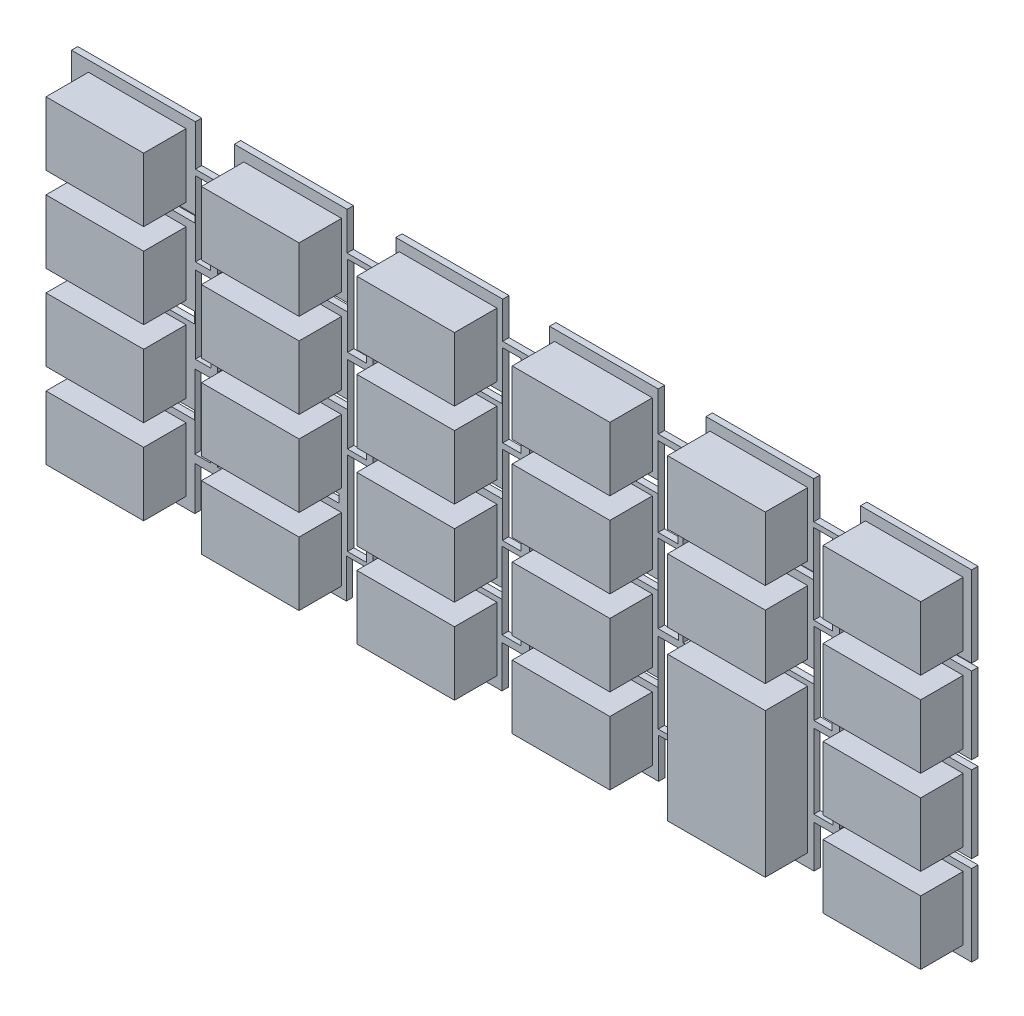
from build123d import *

# Parameters (mm, degrees)
SKETCH1_W           = 129
SKETCH1_H           = 44
MAIN_BODY_DEPTH     = 0.75
SKETCH2_W           = 11.5
SKETCH2_H           = 7.5
SKETCH2_H_2         = 17
BUTTON_BUMPS_DEPTH  = 5
SKETCH5_OUTSIDE_W   = 158.284
SKETCH5_OUTSIDE_H   = 73.284
SKETCH5_OUTSIDE_W_2 = 106
SKETCH5_OUTSIDE_H_2 = 40
CORNERS_CUT_DEPTH   = 69.331910554
SKETCH6_W           = 14.568246905
SKETCH6_H           = 0.848026086
SKETCH6_W_2         = 14.473154159
SKETCH6_H_2         = 1.304965198
SKETCH6_W_3         = 14.505342996
SKETCH6_H_3         = 0.995010591
SKETCH6_W_4         = 4.584155938
SKETCH6_H_4         = 4.837938583
SKETCH6_W_5         = 5.735657466
SKETCH6_H_5         = 4.463820683
SKETCH6_W_6         = 5.514427277
SKETCH6_H_6         = 4.297655594
SKETCH6_W_7         = 5.625874622
SKETCH6_H_7         = 4.60145766
SKETCH6_W_8         = 5.509315921
SKETCH6_H_8         = 4.386561833
SKETCH6_W_9         = 5.565026266
SKETCH6_H_9         = 4.608356471
SKETCH6_W_10        = 5.461498069
SKETCH6_H_10        = 4.941501962
SKETCH6_W_11        = 5.23921742
SKETCH6_H_11        = 4.704273636
SKETCH6_W_12        = 5.536198009
SKETCH6_H_12        = 4.979118435
SKETCH6_W_13        = 12.978627393
SKETCH6_H_13        = 1.030546684
SKETCH6_W_14        = 13.031992161
SKETCH6_H_14        = 0.803321969
SKETCH6_W_15        = 1.795745334
SKETCH6_H_15        = 8.793818954
SKETCH6_W_16        = 1.827354367
SKETCH6_H_16        = 8.687304669
SKETCH6_W_17        = 1.839474041
SKETCH6_H_17        = 9.113432621
SKETCH6_W_18        = 2.286939168
SKETCH6_H_18        = 9.107879913
SKETCH6_W_19        = 13.314460893
SKETCH6_H_19        = 0.929662497
SKETCH6_W_20        = 12.933087604
SKETCH6_W_21        = 12.05802686
SKETCH6_W_22        = 12.487068408
SKETCH6_H_20        = 1.186427825
SKETCH6_W_23        = 12.565634274
SKETCH6_W_24        = 12.527730598
SKETCH6_H_21        = 1.183295374
SKETCH6_W_25        = 12.631461592
SKETCH6_W_26        = 12.983810673
SKETCH6_W_27        = 2.567858478
SKETCH6_H_22        = 9.536701368
SKETCH6_W_28        = 2.495277917
SKETCH6_H_23        = 9.46787123
SKETCH6_W_29        = 2.676342604
SKETCH6_H_24        = 9.375115152
SKETCH6_W_30        = 2.401833493
SKETCH6_H_25        = 9.240031989
SKETCH6_W_31        = 2.199884459
SKETCH6_H_26        = 9.311628659
SKETCH6_W_32        = 2.40038967
SKETCH6_H_27        = 9.690454312
SKETCH6_W_33        = 2.241645238
SKETCH6_H_28        = 9.126088131
SKETCH6_W_34        = 2.719813585
SKETCH6_H_29        = 9.514216934
SKETCH6_W_35        = 2.263541763
SKETCH6_H_30        = 8.772923109
SKETCH6_W_36        = 2.103822083
SKETCH6_H_31        = 9.615272136
SKETCH6_W_37        = 2.195379414
SKETCH6_H_32        = 9.458263553
SKETCH6_W_38        = 2.367247324
SKETCH6_H_33        = 9.358946159
SKETCH6_W_39        = 2.175518118
SKETCH6_H_34        = 9.701561642
SKETCH6_W_40        = 2.23663232
SKETCH6_H_35        = 9.505102034
SKETCH6_W_41        = 2.657476109
SKETCH6_H_36        = 9.144698639
SKETCH6_W_42        = 2.243200893
SKETCH6_H_37        = 9.047380331
SKETCH6_W_43        = 2.736068121
SKETCH6_H_38        = 9.148032888
SKETCH6_W_44        = 1.995311805
SKETCH6_H_39        = 8.780212886
SKETCH6_W_45        = 2.232189122
SKETCH6_H_40        = 8.532256387
SKETCH6_W_46        = 4.925213805
SKETCH6_H_41        = 5.130419433
SKETCH6_H_42        = 9.852027825
SKETCH6_H_43        = 8.987451417
SKETCH6_W_47        = 2.340336211
SKETCH6_W_48        = 12.706733371
SKETCH6_H_44        = 1.393680034
SKETCH6_W_49        = 12.681499888
SKETCH6_H_45        = 1.125609041
SKETCH6_W_50        = 12.767958382
SKETCH6_H_46        = 9.461657873
SKETCH6_H_47        = 9.451630049
SKETCH6_W_51        = 12.647476461
SKETCH6_H_48        = 1.561474162
SKETCH6_H_49        = 8.680138858
INKEYS_CUT_DEPTH    = 57.868268832
BUTTON_SPACE_START  = -3
SKETCH7_W           = 6.75
SKETCH7_H           = 6.75
BUTTON_SPACE_DEPTH  = 3


with BuildPart() as part:
    # Sketch1 → main_body (new body)
    with BuildSketch(Plane.XY):
        Rectangle(SKETCH1_W, SKETCH1_H)
    extrude(amount=MAIN_BODY_DEPTH)

    # Sketch2 → button_bumps (add)
    with BuildSketch(Plane.XY.offset(0.75)):
        with Locations((-45.25, 15)):
            Rectangle(SKETCH2_W, SKETCH2_H)
        with Locations((-45.25, 5)):
            Rectangle(SKETCH2_W, SKETCH2_H)
        with Locations((-26.95, 5)):
            Rectangle(SKETCH2_W, SKETCH2_H)
        with Locations((-8.65, 5)):
            Rectangle(SKETCH2_W, SKETCH2_H)
        with Locations((9.65, 5)):
            Rectangle(SKETCH2_W, SKETCH2_H)
        with Locations((27.95, 5)):
            Rectangle(SKETCH2_W, SKETCH2_H)
        with Locations((46.25, -5)):
            Rectangle(SKETCH2_W, SKETCH2_H)
        with Locations((46.25, -15)):
            Rectangle(SKETCH2_W, SKETCH2_H)
        with Locations((46.25, 15)):
            Rectangle(SKETCH2_W, SKETCH2_H)
        with Locations((-45.25, -5)):
            Rectangle(SKETCH2_W, SKETCH2_H)
        with Locations((-45.25, -15)):
            Rectangle(SKETCH2_W, SKETCH2_H)
        with Locations((-26.95, 15)):
            Rectangle(SKETCH2_W, SKETCH2_H)
        with Locations((-26.95, -5)):
            Rectangle(SKETCH2_W, SKETCH2_H)
        with Locations((-26.95, -15)):
            Rectangle(SKETCH2_W, SKETCH2_H)
        with Locations((-8.65, -5)):
            Rectangle(SKETCH2_W, SKETCH2_H)
        with Locations((-8.65, -15)):
            Rectangle(SKETCH2_W, SKETCH2_H)
        with Locations((-8.65, 15)):
            Rectangle(SKETCH2_W, SKETCH2_H)
        with Locations((9.65, 15)):
            Rectangle(SKETCH2_W, SKETCH2_H)
        with Locations((9.65, -5)):
            Rectangle(SKETCH2_W, SKETCH2_H)
        with Locations((9.65, -15)):
            Rectangle(SKETCH2_W, SKETCH2_H)
        with Locations((27.95, 15)):
            Rectangle(SKETCH2_W, SKETCH2_H)
        with Locations((46.25, 5)):
            Rectangle(SKETCH2_W, SKETCH2_H)
        with Locations((27.95, -10)):
            Rectangle(SKETCH2_W, SKETCH2_H_2)
    extrude(amount=BUTTON_BUMPS_DEPTH)

    # Sketch5 outside → corners_cut (cut, through all)
    with BuildSketch(Plane.XY.offset(0.75)):
        Rectangle(SKETCH5_OUTSIDE_W, SKETCH5_OUTSIDE_H)
        Rectangle(SKETCH5_OUTSIDE_W_2, SKETCH5_OUTSIDE_H_2, mode=Mode.SUBTRACT)
    extrude(amount=-CORNERS_CUT_DEPTH, mode=Mode.SUBTRACT)

    # Sketch6 → inkeys_cut (cut, through all)
    with BuildSketch(Plane.XY.offset(0.75)):
        with Locations((-45.715876548, 10.062979309)):
            Rectangle(SKETCH6_W, SKETCH6_H)
        with Locations((-45.763422921, -0.024683031)):
            Rectangle(SKETCH6_W_2, SKETCH6_H_2)
        with Locations((-45.747328502, -9.961956009)):
            Rectangle(SKETCH6_W_3, SKETCH6_H_3)
        with Locations((-36.12036384, 17.581030709)):
            Rectangle(SKETCH6_W_4, SKETCH6_H_4)
        with Locations((-17.678703451, 17.768089658)):
            Rectangle(SKETCH6_W_5, SKETCH6_H_5)
        with Locations((0.536541957, 17.851172203)):
            Rectangle(SKETCH6_W_6, SKETCH6_H_6)
        with Locations((18.908881842, 17.69927117)):
            Rectangle(SKETCH6_W_7, SKETCH6_H_7)
        with Locations((37.156358346, 17.806719083)):
            Rectangle(SKETCH6_W_8, SKETCH6_H_8)
        with Locations((-17.847969843, -17.695821764)):
            Rectangle(SKETCH6_W_9, SKETCH6_H_9)
        with Locations((0.418907381, -17.529249019)):
            Rectangle(SKETCH6_W_10, SKETCH6_H_10)
        with Locations((18.761224565, -17.647863182)):
            Rectangle(SKETCH6_W_11, SKETCH6_H_11)
        with Locations((37.204414304, -17.510440783)):
            Rectangle(SKETCH6_W_12, SKETCH6_H_12)
        with Locations((46.510686304, 0.112526226)):
            Rectangle(SKETCH6_W_13, SKETCH6_H_13)
        with Locations((46.484003919, 10.085331368)):
            Rectangle(SKETCH6_W_14, SKETCH6_H_14)
        with Locations((-37.514569142, 10.103721978)):
            Rectangle(SKETCH6_W_15, SKETCH6_H_15)
        with Locations((-37.561810855, -9.581202914)):
            Rectangle(SKETCH6_W_16, SKETCH6_H_16)
        with Locations((-37.50398771, 0.333322626)):
            Rectangle(SKETCH6_W_17, SKETCH6_H_17)
        with Locations((-34.64986401, 0.312607174)):
            Rectangle(SKETCH6_W_18, SKETCH6_H_18)
        with Locations((-27.16180613, 10.022161104)):
            Rectangle(SKETCH6_W_19, SKETCH6_H_19)
        with Locations((-26.97609886, 0.112526226)):
            Rectangle(SKETCH6_W_20, SKETCH6_H_13)
        with Locations((-27.505632749, -9.961956009)):
            Rectangle(SKETCH6_W_21, SKETCH6_H_3)
        with Locations((-8.52639711, 9.89377844)):
            Rectangle(SKETCH6_W_22, SKETCH6_H_20)
        with Locations((-8.551534653, 0.112526226)):
            Rectangle(SKETCH6_W_23, SKETCH6_H_13)
        with Locations((-8.572532797, -10.056098401)):
            Rectangle(SKETCH6_W_24, SKETCH6_H_21)
        with Locations((28.052139988, 10.085331368)):
            Rectangle(SKETCH6_W_25, SKETCH6_H_14)
        with Locations((46.519429734, -9.961956009)):
            Rectangle(SKETCH6_W_26, SKETCH6_H_3)
        with Locations((38.727072276, 0.118770263)):
            Rectangle(SKETCH6_W_27, SKETCH6_H_22)
        with Locations((38.707492977, 10.285902794)):
            Rectangle(SKETCH6_W_28, SKETCH6_H_23)
        with Locations((20.367578698, 10.045379944)):
            Rectangle(SKETCH6_W_29, SKETCH6_H_24)
        with Locations((17.282006841, 0.16984368)):
            Rectangle(SKETCH6_W_30, SKETCH6_H_25)
        with Locations((-1.155824946, 0.029447447)):
            Rectangle(SKETCH6_W_31, SKETCH6_H_26)
        with Locations((2.15361422, 10.221756657)):
            Rectangle(SKETCH6_W_32, SKETCH6_H_27)
        with Locations((-19.37584849, 0.143606)):
            Rectangle(SKETCH6_W_33, SKETCH6_H_28)
        with Locations((-16.148075549, 10.198611222)):
            Rectangle(SKETCH6_W_34, SKETCH6_H_29)
        with Locations((35.548570556, -9.817268635)):
            Rectangle(SKETCH6_W_35, SKETCH6_H_30)
        with Locations((35.510371132, 0.16433252)):
            Rectangle(SKETCH6_W_36, SKETCH6_H_31)
        with Locations((35.499390092, 10.301590284)):
            Rectangle(SKETCH6_W_37, SKETCH6_H_32)
        with Locations((17.268349373, 10.042296988)):
            Rectangle(SKETCH6_W_38, SKETCH6_H_33)
        with Locations((-1.132912622, 10.193149893)):
            Rectangle(SKETCH6_W_39, SKETCH6_H_34)
        with Locations((-19.373849603, 10.194053772)):
            Rectangle(SKETCH6_W_40, SKETCH6_H_35)
        with Locations((-16.174846497, 0.155205002)):
            Rectangle(SKETCH6_W_41, SKETCH6_H_36)
        with Locations((-1.177394124, -9.750442882)):
            Rectangle(SKETCH6_W_42, SKETCH6_H_37)
        with Locations((20.389806416, 0.15904243)):
            Rectangle(SKETCH6_W_43, SKETCH6_H_38)
        with Locations((-34.825941774, 10.110525012)):
            Rectangle(SKETCH6_W_44, SKETCH6_H_39)
        with Locations((-34.677239033, -9.658727054)):
            Rectangle(SKETCH6_W_45, SKETCH6_H_40)
        with Locations((-36.012881136, -17.435758405)):
            Rectangle(SKETCH6_W_46, SKETCH6_H_41)
        with Locations((-19.37584849, -9.944534777)):
            Rectangle(SKETCH6_W_33, SKETCH6_H_42)
        with Locations((-16.174846497, -9.944534777)):
            Rectangle(SKETCH6_W_41, SKETCH6_H_42)
        with Locations((2.15361422, -0.132641173)):
            Rectangle(SKETCH6_W_32, SKETCH6_H_43)
        with Locations((2.12358749, -9.750442882)):
            Rectangle(SKETCH6_W_47, SKETCH6_H_37)
        with Locations((9.716769331, 9.988067422)):
            Rectangle(SKETCH6_W_48, SKETCH6_H_44)
        with Locations((9.710108557, -0.013313814)):
            Rectangle(SKETCH6_W_49, SKETCH6_H_45)
        with Locations((9.69128785, -9.961956009)):
            Rectangle(SKETCH6_W_50, SKETCH6_H_3)
        with Locations((17.282006841, -9.957581654)):
            Rectangle(SKETCH6_W_30, SKETCH6_H_46)
        with Locations((20.389806416, -9.962595565)):
            Rectangle(SKETCH6_W_43, SKETCH6_H_47)
        with Locations((28.108917943, -0.152937513)):
            Rectangle(SKETCH6_W_51, SKETCH6_H_48)
        with Locations((38.727072276, -9.86366076)):
            Rectangle(SKETCH6_W_27, SKETCH6_H_49)
    extrude(amount=-INKEYS_CUT_DEPTH, mode=Mode.SUBTRACT)

    # Sketch7 → button_space (cut)
    with BuildSketch(Plane.XY.offset(5.75).offset(BUTTON_SPACE_START)):
        with Locations((-45.25, 15)):
            Rectangle(SKETCH7_W, SKETCH7_H)
        with Locations((-45.25, 5)):
            Rectangle(SKETCH7_W, SKETCH7_H)
        with Locations((-45.25, -5)):
            Rectangle(SKETCH7_W, SKETCH7_H)
        with Locations((-45.25, -15)):
            Rectangle(SKETCH7_W, SKETCH7_H)
        with Locations((-26.95, 15)):
            Rectangle(SKETCH7_W, SKETCH7_H)
        with Locations((-26.95, 5)):
            Rectangle(SKETCH7_W, SKETCH7_H)
        with Locations((-26.95, -5)):
            Rectangle(SKETCH7_W, SKETCH7_H)
        with Locations((-26.95, -15)):
            Rectangle(SKETCH7_W, SKETCH7_H)
        with Locations((-8.65, 15)):
            Rectangle(SKETCH7_W, SKETCH7_H)
        with Locations((-8.65, 5)):
            Rectangle(SKETCH7_W, SKETCH7_H)
        with Locations((-8.65, -5)):
            Rectangle(SKETCH7_W, SKETCH7_H)
        with Locations((-8.65, -15)):
            Rectangle(SKETCH7_W, SKETCH7_H)
        with Locations((9.65, -15)):
            Rectangle(SKETCH7_W, SKETCH7_H)
        with Locations((9.65, -5)):
            Rectangle(SKETCH7_W, SKETCH7_H)
        with Locations((9.65, 5)):
            Rectangle(SKETCH7_W, SKETCH7_H)
        with Locations((9.65, 15)):
            Rectangle(SKETCH7_W, SKETCH7_H)
        with Locations((27.95, 15)):
            Rectangle(SKETCH7_W, SKETCH7_H)
        with Locations((27.95, 5)):
            Rectangle(SKETCH7_W, SKETCH7_H)
        with Locations((46.25, 15)):
            Rectangle(SKETCH7_W, SKETCH7_H)
        with Locations((46.25, 5)):
            Rectangle(SKETCH7_W, SKETCH7_H)
        with Locations((46.25, -5)):
            Rectangle(SKETCH7_W, SKETCH7_H)
        with Locations((46.25, -15)):
            Rectangle(SKETCH7_W, SKETCH7_H)
        with Locations((27.95, -10)):
            Rectangle(SKETCH7_W, SKETCH7_H)
    extrude(amount=-BUTTON_SPACE_DEPTH, mode=Mode.SUBTRACT)


solid = part.part
